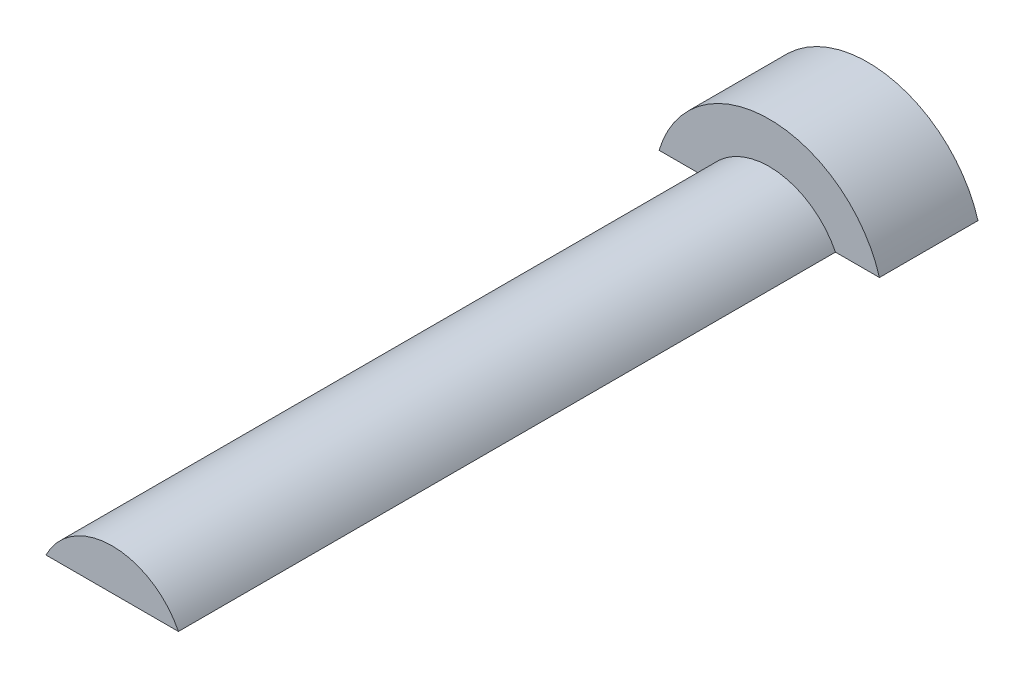
from build123d import *

# Parameters (mm, degrees)
BOSS_EXTRUDE1_DEPTH = 3
BOSS_EXTRUDE2_DEPTH = 20


with BuildPart() as part:
    # Sketch1 → Boss-Extrude1 (new body)
    with BuildSketch(Plane.XY):
        with BuildLine():
            ThreePointArc((3.354101966, 1), (0, 3.5), (-3.354101966, 1))
            Line((-3.354101966, 1), (3.354101966, 1))
        make_face()
    extrude(amount=BOSS_EXTRUDE1_DEPTH)

    # Sketch2 → Boss-Extrude2 (add)
    with BuildSketch(Plane.XY.offset(3)):
        with BuildLine():
            ThreePointArc((2.015564437, 1), (0, 2.25), (-2.015564437, 1))
            Line((-2.015564437, 1), (2.015564437, 1))
        make_face()
    extrude(amount=BOSS_EXTRUDE2_DEPTH)


solid = part.part
